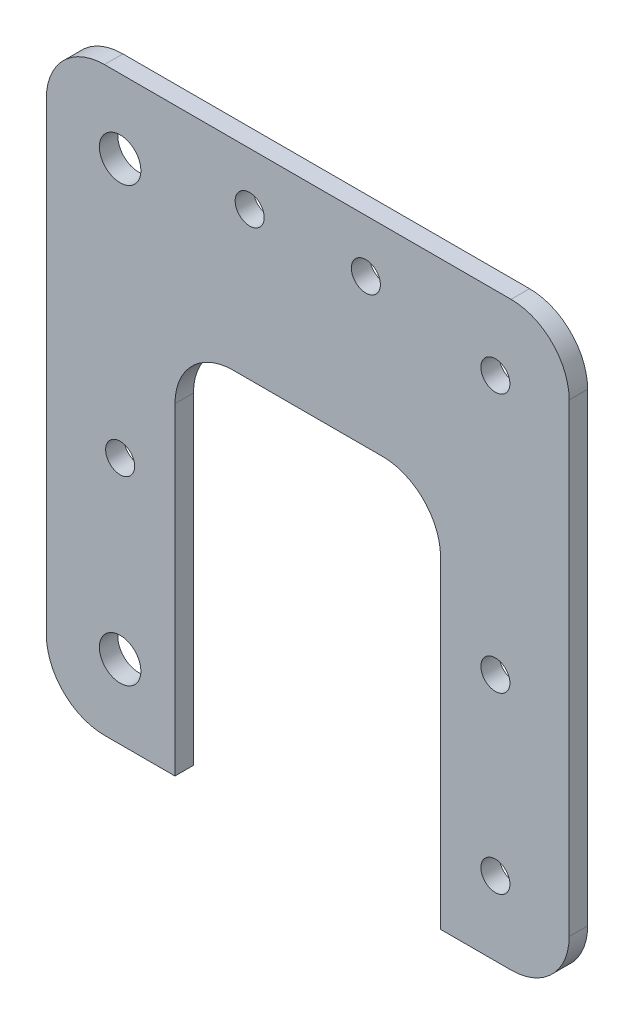
from build123d import *

# Parameters (mm, degrees)
BOSS_EXTRUDE1_START = 19.16
SKETCH1_W           = 90
SKETCH1_H           = 100
SKETCH1_R           = 2.5
SKETCH1_R_2         = 3.57
BOSS_EXTRUDE1_DEPTH = 3.18
SKETCH2_W           = 45.72
SKETCH2_H           = 65.511870912
CUT_EXTRUDE1_DEPTH  = 72.134467033
FILLET1_R           = 10
SKETCH3_R           = 2.5
CUT_EXTRUDE2_DEPTH  = 72.134467033


with BuildPart() as part:
    # Sketch1 → Boss-Extrude1 (new body)
    with BuildSketch(Plane.XY.offset(BOSS_EXTRUDE1_START)):
        with Locations((0, -5)):
            Rectangle(SKETCH1_W, SKETCH1_H)
        with Locations((32.3, -12.3)):
            Circle(SKETCH1_R, mode=Mode.SUBTRACT)
        with Locations((32.3, -42.3)):
            Circle(SKETCH1_R, mode=Mode.SUBTRACT)
        with Locations((-32.3, -42.3)):
            Circle(SKETCH1_R_2, mode=Mode.SUBTRACT)
        with Locations((-32.3, -12.3)):
            Circle(SKETCH1_R, mode=Mode.SUBTRACT)
        with Locations((-32.3, 32.3)):
            Circle(SKETCH1_R_2, mode=Mode.SUBTRACT)
        with Locations((32.3, 32.3)):
            Circle(SKETCH1_R, mode=Mode.SUBTRACT)
    extrude(amount=-BOSS_EXTRUDE1_DEPTH)

    # Sketch2 → Cut-Extrude1 (cut, through all)
    with BuildSketch(Plane(origin=(0, 0, 15.98), x_dir=(-1, 0, 0), z_dir=(0, 0, -1))):
        with Locations((0, -22.244064544)):
            Rectangle(SKETCH2_W, SKETCH2_H)
    extrude(amount=-CUT_EXTRUDE1_DEPTH, mode=Mode.SUBTRACT)

    # Fillet1
    fillet1_edges = [part.edges().sort_by_distance(p)[0] for p in [
        (45, -55, 17.57),
        (-45, -55, 17.57),
        (-45, 45, 17.57),
        (45, 45, 17.57),
        (-22.86, 10.511870912, 17.57),
        (22.86, 10.511870912, 17.57),
    ]]
    fillet(fillet1_edges, radius=FILLET1_R)

    # Sketch3 → Cut-Extrude2 (cut, through all)
    with BuildSketch(Plane.XY.offset(19.16)):
        with Locations((10.000000005, 35.930865744)):
            Circle(SKETCH3_R)
        with Locations((-9.999999995, 35.930865744)):
            Circle(SKETCH3_R)
    extrude(amount=-CUT_EXTRUDE2_DEPTH, mode=Mode.SUBTRACT)


solid = part.part
